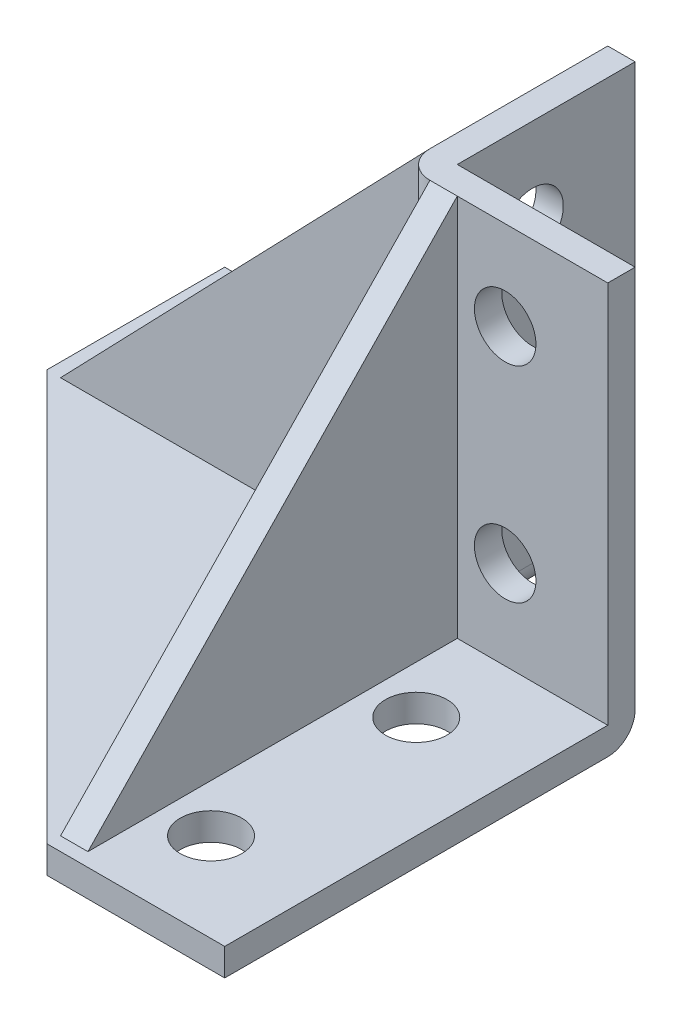
from build123d import *

# Parameters (mm, degrees)
BASE_PLATE_DEPTH      = 6.35
SKETCH2_W             = 6.35
SKETCH2_H             = 47.625
UPPER_LEAF_DEPTH      = 88.9
LOFT1_START           = 34.925
LOFT1_DEPTH           = 6.35
SKETCH10_W            = 7.14375
SKETCH10_H            = 47.62505
SKETCH10_AT_POINT_2_W = 7.14375
SKETCH10_AT_POINT_2_H = 47.62505
SKETCH10_AT_POINT_3_W = 7.14375
SKETCH10_AT_POINT_3_H = 47.62505
SKETCH10_AT_POINT_4_W = 7.14375
SKETCH10_AT_POINT_4_H = 47.62505
FILLET1_R             = 6.35


# Read off the part's stored shape, not the designer's step: Loft1, Mirror1
with BuildPart() as part:
    # Sketch1 → Base Plate (new body)
    with BuildSketch(Plane(origin=(0, 0, 0), x_dir=(1, 0, 0), z_dir=(0, 1, 0))):
        Polygon((-136.525, 0), (-41.275, 0), (-41.275, -41.275), (0, -41.275), (0, -136.525), (-41.275, -136.525), (-136.525, -41.275), align=None)
    extrude(amount=BASE_PLATE_DEPTH)

    # Sketch2 → Upper Leaf (add)
    with BuildSketch(Plane(origin=(0, 6.35, 0), x_dir=(1, 0, 0), z_dir=(0, 1, 0))):
        with Locations((-44.45, -23.8125)):
            Rectangle(SKETCH2_W, SKETCH2_H)
    extrude(amount=UPPER_LEAF_DEPTH)

    # Loft1 outline → Loft1 (add)
    with BuildSketch(Plane.XY.offset(LOFT1_START)):
        Polygon((-47.625, 6.35), (-47.625, 95.25), (-133.35, 6.35), align=None)
    extrude(amount=LOFT1_DEPTH)

    # Sketch10 → 9/16 (0.5625) Diameter Hole1 (revolve, cut)
    with BuildSketch(Plane(origin=(-47.625, 74.6125, 23.8125), x_dir=(0, 0, 1), z_dir=(0, 1, 0))):
        with Locations((3.571875, 23.812525)):
            Rectangle(SKETCH10_W, SKETCH10_H)
    revolve(axis=Axis((-53.975, 74.6125, 23.8125), (1, 0, 0)), mode=Mode.SUBTRACT)

    # Sketch10 at point 2 (carried to point 2, square into its face) → 9/16 (0.5625) Diameter Hole1 at 2 (revolve, cut)
    with BuildSketch(Plane(origin=(-47.625, 26.9875, 23.8125), x_dir=(0, 0, 1), z_dir=(0, 1, 0))):
        with Locations((3.571875, 23.812525)):
            Rectangle(SKETCH10_AT_POINT_2_W, SKETCH10_AT_POINT_2_H)
    revolve(axis=Axis((-53.975, 26.9875, 23.8125), (1, 0, 0)), mode=Mode.SUBTRACT)

    # Sketch10 at point 3 (carried to point 3, square into its face) → 9/16 (0.5625) Diameter Hole1 at 3 (revolve, cut)
    with BuildSketch(Plane(origin=(-68.2625, 6.35, 23.8125), x_dir=(0, 0, 1), z_dir=(1, 0, 0))):
        with Locations((3.571875, 23.812525)):
            Rectangle(SKETCH10_AT_POINT_3_W, SKETCH10_AT_POINT_3_H)
    revolve(axis=Axis((-68.2625, 12.7, 23.8125), (0, -1, 0)), mode=Mode.SUBTRACT)

    # Sketch10 at point 4 (carried to point 4, square into its face) → 9/16 (0.5625) Diameter Hole1 at 4 (revolve, cut)
    with BuildSketch(Plane(origin=(-115.8875, 6.35, 23.8125), x_dir=(0, 0, 1), z_dir=(1, 0, 0))):
        with Locations((3.571875, 23.812525)):
            Rectangle(SKETCH10_AT_POINT_4_W, SKETCH10_AT_POINT_4_H)
    revolve(axis=Axis((-115.8875, 12.7, 23.8125), (0, -1, 0)), mode=Mode.SUBTRACT)

    # Mirror1
    split(bisect_by=Plane(origin=(0, 0, 0), x_dir=(-0.7071067811865476, 0, 0.7071067811865476), z_dir=(0.7071067811865477, 0, 0.7071067811865475)), keep=Keep.BOTTOM)

    # Mirror1 2: part across plane


with BuildPart() as part_1:
    add(part.part)
    add(part.part.mirror(Plane(origin=(0, 0, 0), x_dir=(-0.7071067811865476, 0, 0.7071067811865476), z_dir=(0.7071067811865477, 0, 0.7071067811865475))))

    # Fillet1
    fillet1_edges = [part_1.edges().sort_by_distance(p)[0] for p in [
        (-41.275, 0, 20.6375),
        (-20.6375, 0, 41.275),
        (-47.625, 50.8, 47.625),
    ]]
    fillet(fillet1_edges, radius=FILLET1_R - 0.0001)  # a hair under: the kernel refuses the full size


solid = part_1.part
